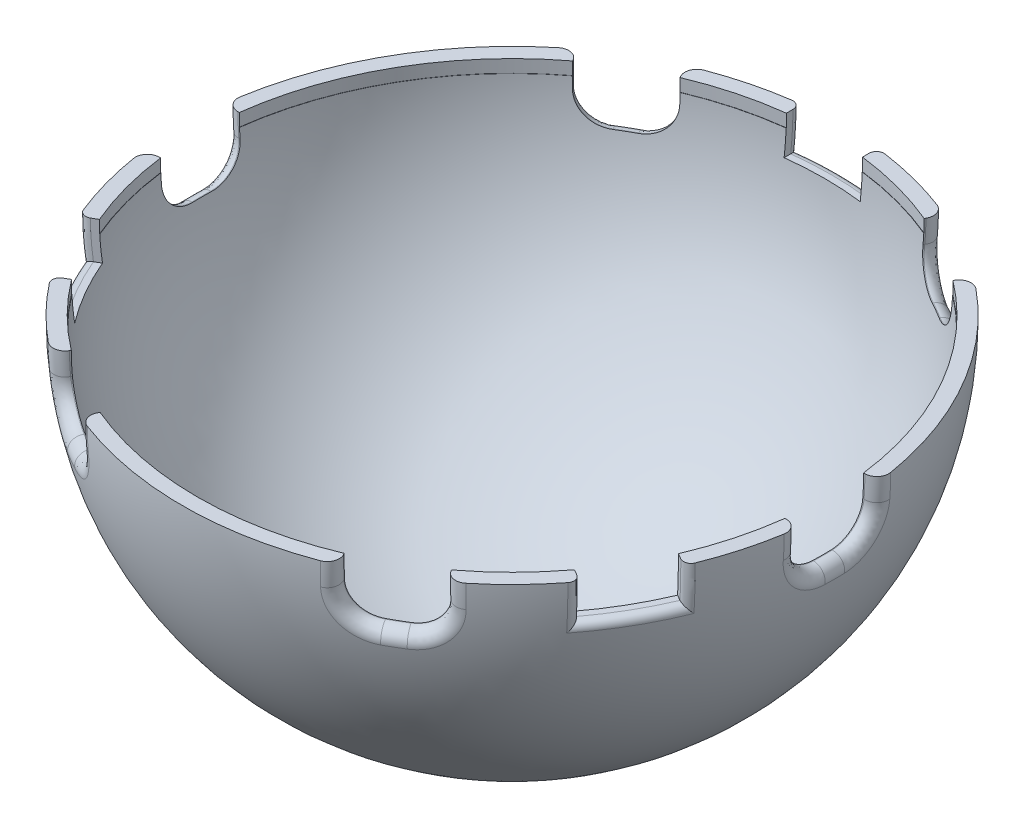
from build123d import *

# Parameters (mm, degrees)
SKETCH5_R                = 21
CUT_EXTRUDE1_DEPTH       = 0.85
SKETCH33_W               = 5.08
SKETCH33_H               = 3.88872151
CUT_EXTRUDE11_DEPTH      = 2.5
FILLET4_R                = 0.5
CIRPATTERN3_COUNT        = 3
FILLET4_OF_CIRPATTERN3_R = 0.5
SKETCH42_W               = 7.613205358
SKETCH42_H               = 5.25
CUT_EXTRUDE12_DEPTH      = 3.5
FILLET5_R                = 2
FILLET6_R                = 0.8
CIRPATTERN8_COUNT        = 6
FILLET5_OF_CIRPATTERN8_R = 2
FILLET6_OF_CIRPATTERN8_R = 0.8


with BuildPart() as part:
    # Sketch3 → Revolve1 (revolve)
    with BuildSketch(Plane.XY):
        with BuildLine():
            Line((-22, 0), (0, 0))
            Line((0, 0), (0, -22))
            ThreePointArc((0, -22), (-15.556349186, -15.556349186), (-22, 0))
        make_face()
    revolve(axis=Axis((0, 18.793797917, 0), (0, -1, 0)))

    # Sketch4 → Cut-Revolve1 (revolve, cut)
    with BuildSketch(Plane.XY):
        with BuildLine():
            Line((21, 0), (0, 0))
            Line((0, 0), (0, -21))
            ThreePointArc((0, -21), (14.849242405, -14.849242405), (21, 0))
        make_face()
    revolve(axis=Axis((0, 18.793797917, 0), (0, -1, 0)), mode=Mode.SUBTRACT)

    # Sketch5 → Cut-Extrude1 (cut)
    with BuildSketch(Plane(origin=(0, 0, 0), x_dir=(1, 0, 0), z_dir=(0, 1, 0))):
        Circle(SKETCH5_R)
    extrude(amount=-CUT_EXTRUDE1_DEPTH, mode=Mode.SUBTRACT)

    # Sketch33 → Cut-Extrude11 (cut)
    with BuildSketch(Plane(origin=(0, 0, 0), x_dir=(1, 0, 0), z_dir=(0, 1, 0))):
        with Locations((0, 21)):
            Rectangle(SKETCH33_W, SKETCH33_H)
    cut_extrude11 = extrude(amount=-CUT_EXTRUDE11_DEPTH, mode=Mode.SUBTRACT)

    # Fillet4
    fillet4_edges = [part.edges().sort_by_distance(p)[0] for p in [
        (-2.54, -1.25205675, -21.816983153),
        (2.54, -1.25205675, -21.816983153),
        (0, -2.5, -21.857492994),
    ]]
    fillet(fillet4_edges, radius=FILLET4_R)

    # CirPattern3: Cut-Extrude11 ×3 about axis
    cirpattern3_axis = Axis((0, 18.793797917, 0), (0, -1, 0))
    for i in range(1, CIRPATTERN3_COUNT):
        add(cut_extrude11.rotate(cirpattern3_axis, i * 360 / CIRPATTERN3_COUNT), mode=Mode.SUBTRACT)

    # Fillet4 of CirPattern3
    fillet4_of_cirpattern3_edges = [part.edges().sort_by_distance(p)[0] for p in [
        (20.164061644, -1.25205675, 8.708787051),
        (17.624061644, -1.25205675, 13.108196102),
        (18.929144196, -2.5, 10.928746497),
        (-17.624061644, -1.25205675, 13.108196102),
        (-20.164061644, -1.25205675, 8.708787051),
        (-18.929144196, -2.5, 10.928746497),
    ]]
    fillet(fillet4_of_cirpattern3_edges, radius=FILLET4_OF_CIRPATTERN3_R)

    # Sketch42 → Cut-Extrude12 (cut)
    with BuildSketch(Plane(origin=(0, 0, 0), x_dir=(1, 0, 0), z_dir=(0, 1, 0))):
        with Locations((20.9624408, 0)):
            Rectangle(SKETCH42_W, SKETCH42_H)
    cut_extrude12 = extrude(amount=-CUT_EXTRUDE12_DEPTH, mode=Mode.SUBTRACT)

    # Fillet5
    fillet5_edges = [part.edges().sort_by_distance(p)[0] for p in [
        (21.049906641, -3.5, 2.625),
        (21.049906641, -3.5, -2.625),
    ]]
    fillet(fillet5_edges, radius=FILLET5_R)

    # Fillet6
    fillet6_edges = [part.edges().sort_by_distance(p)[0] for p in [
        (21.829938393, -0.75044303, 2.625),
        (21.710600664, -2.913520185, 2.039906598),
        (21.719806629, -3.5, 0),
        (21.710600664, -2.913520185, -2.039906598),
        (21.829938393, -0.75044303, -2.625),
    ]]
    fillet(fillet6_edges, radius=FILLET6_R)

    # CirPattern8: Cut-Extrude12 ×6 about axis
    cirpattern8_axis = Axis((0, 18.793797917, 0), (0, -1, 0))
    for i in range(1, CIRPATTERN8_COUNT):
        add(cut_extrude12.rotate(cirpattern8_axis, i * 360 / CIRPATTERN8_COUNT), mode=Mode.SUBTRACT)

    # Fillet5 of CirPattern8
    fillet5_of_cirpattern8_edges = [part.edges().sort_by_distance(p)[0] for p in [
        (8.251636636, -3.5, 19.542253898),
        (12.798270005, -3.5, 16.917253898),
        (-12.798270005, -3.5, 16.917253898),
        (-8.251636636, -3.5, 19.542253898),
        (-21.049906641, -3.5, -2.625),
        (-21.049906641, -3.5, 2.625),
        (-8.251636636, -3.5, -19.542253898),
        (-12.798270005, -3.5, -16.917253898),
        (12.798270005, -3.5, -16.917253898),
        (8.251636636, -3.5, -19.542253898),
    ]]
    fillet(fillet5_of_cirpattern8_edges, radius=FILLET5_OF_CIRPATTERN8_R)

    # Fillet6 of CirPattern8
    fillet6_of_cirpattern8_edges = [part.edges().sort_by_distance(p)[0] for p in [
        (8.641652512, -0.75044303, 20.217781212),
        (9.088689396, -2.913520185, 19.821885006),
        (10.859903314, -3.5, 18.809904306),
        (12.621911268, -2.913520185, 17.781978407),
        (13.188285882, -0.75044303, 17.592781212),
        (-13.188285882, -0.75044303, 17.592781212),
        (-12.621911268, -2.913520185, 17.781978407),
        (-10.859903314, -3.5, 18.809904306),
        (-9.088689396, -2.913520185, 19.821885006),
        (-8.641652512, -0.75044303, 20.217781212),
        (-21.829938393, -0.75044303, -2.625),
        (-21.710600664, -2.913520185, -2.039906598),
        (-21.719806629, -3.5, 0),
        (-21.710600664, -2.913520185, 2.039906598),
        (-21.829938393, -0.75044303, 2.625),
        (-8.641652512, -0.75044303, -20.217781212),
        (-9.088689396, -2.913520185, -19.821885006),
        (-10.859903314, -3.5, -18.809904306),
        (-12.621911268, -2.913520185, -17.781978407),
        (-13.188285882, -0.75044303, -17.592781212),
        (13.188285882, -0.75044303, -17.592781212),
        (12.621911268, -2.913520185, -17.781978407),
        (10.859903314, -3.5, -18.809904306),
        (9.088689396, -2.913520185, -19.821885006),
        (8.641652512, -0.75044303, -20.217781212),
    ]]
    fillet(fillet6_of_cirpattern8_edges, radius=FILLET6_OF_CIRPATTERN8_R)


solid = part.part
